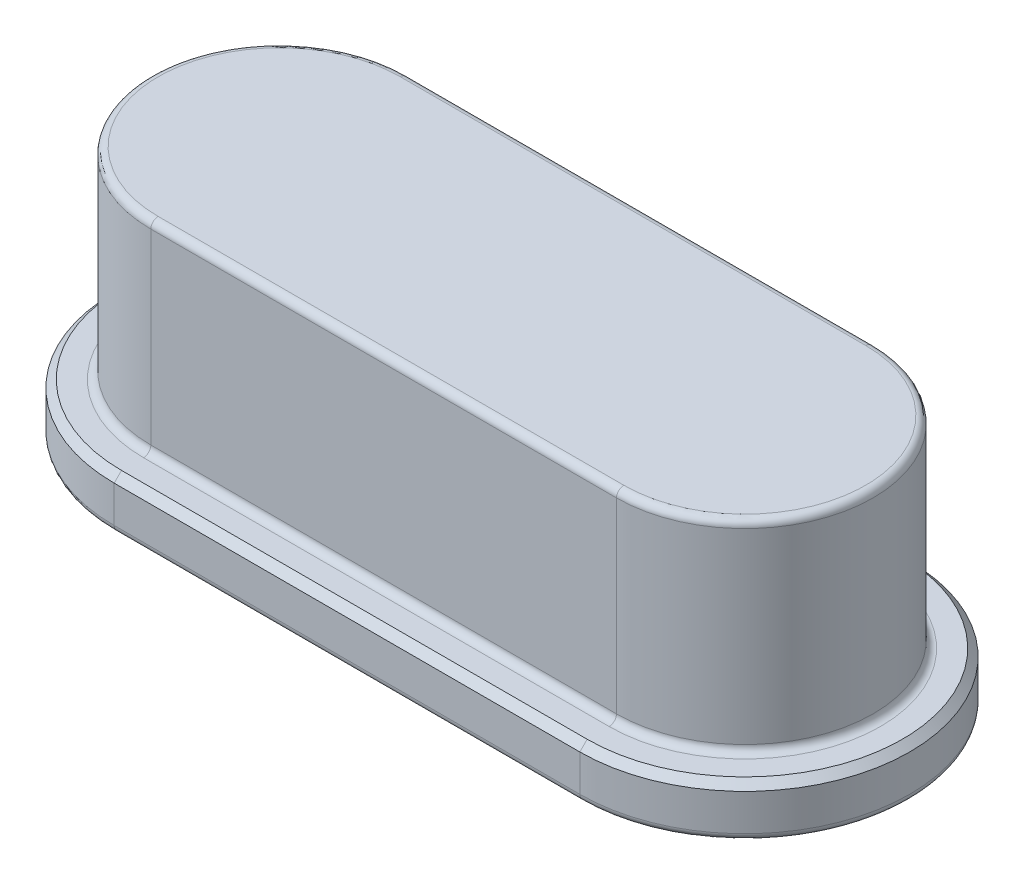
from build123d import *

# Parameters (mm, degrees)
BOSS_EXTRU_1_DEPTH = 0.7
BOSS_EXTRU_2_DEPTH = 2.75
CONG_1_R           = 0.1
CONG_2_R           = 0.1
CONG_3_R           = 0.1
CHANFREIN1_SIZE    = 0.1


with BuildPart() as part:
    # Esquisse1 → Boss.-Extru.1 (new body)
    with BuildSketch(Plane(origin=(0, 0, 0), x_dir=(1, 0, 0), z_dir=(0, 1, 0))):
        with BuildLine():
            Line((0, 2.25), (6.35, 2.25))
            ThreePointArc((6.35, 2.25), (8.6, 0), (6.35, -2.25))
            Line((6.35, -2.25), (0, -2.25))
            ThreePointArc((0, -2.25), (-2.25, 0), (0, 2.25))
        make_face()
    extrude(amount=BOSS_EXTRU_1_DEPTH)

    # Esquisse2 → Boss.-Extru.2 (add)
    with BuildSketch(Plane(origin=(0, 0.7, 0), x_dir=(1, 0, 0), z_dir=(0, 1, 0))):
        with BuildLine():
            Line((0, 1.75), (6.35, 1.75))
            ThreePointArc((6.35, 1.75), (8.1, 0), (6.35, -1.75))
            Line((6.35, -1.75), (0, -1.75))
            ThreePointArc((0, -1.75), (-1.75, 0), (0, 1.75))
        make_face()
    extrude(amount=BOSS_EXTRU_2_DEPTH)

    # Congé1
    cong_1_edges = [part.edges().sort_by_distance(p)[0] for p in [
        (3.175, 0.7, -1.75),
        (8.1, 0.7, 0),
        (3.175, 0.7, 1.75),
        (-1.75, 0.7, 0),
    ]]
    fillet(cong_1_edges, radius=CONG_1_R)

    # Congé2
    cong_2_edges = [part.edges().sort_by_distance(p)[0] for p in [
        (-1.75, 3.45, 0),
        (3.175, 3.45, 1.75),
        (3.175, 3.45, -1.75),
        (8.1, 3.45, 0),
    ]]
    fillet(cong_2_edges, radius=CONG_2_R)

    # Congé3
    cong_3_edges = [part.edges().sort_by_distance(p)[0] for p in [
        (3.175, 0, -2.25),
        (-2.25, 0, 0),
        (3.175, 0, 2.25),
        (8.6, 0, 0),
    ]]
    fillet(cong_3_edges, radius=CONG_3_R)

    # Chanfrein1
    chanfrein1_edges = [part.edges().sort_by_distance(p)[0] for p in [
        (3.175, 0.7, -2.25),
        (8.6, 0.7, 0),
        (3.175, 0.7, 2.25),
        (-2.25, 0.7, 0),
    ]]
    chamfer(chanfrein1_edges, length=CHANFREIN1_SIZE)


solid = part.part
